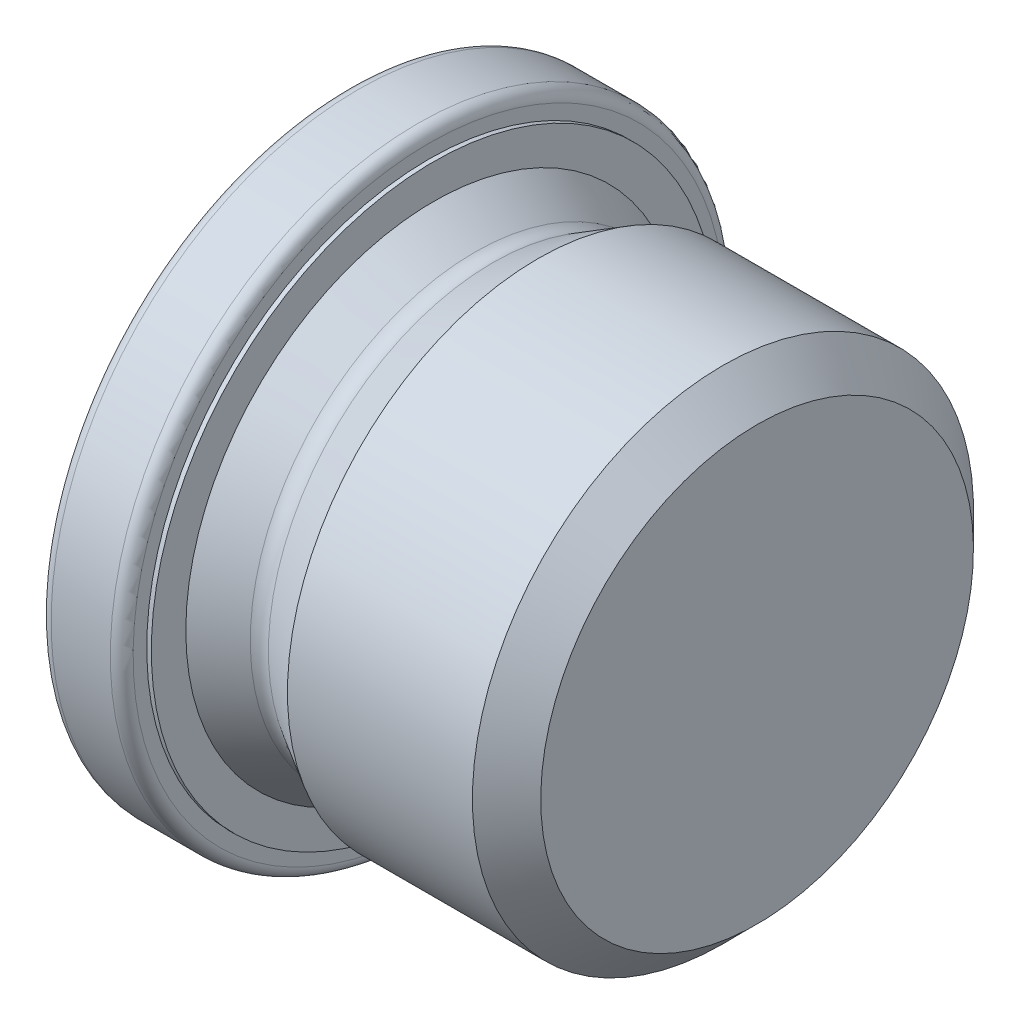
from build123d import *

# Parameters (mm, degrees)
SKETCH2_W          = 9.6
SKETCH2_H          = 9.6
CUT_EXTRUDE1_DEPTH = 10
FILLET1_R          = 0.5
SKETCH3_W          = 1.5
SKETCH3_H          = 2


with BuildPart() as part:
    # Sketch1 → Revolve1 (revolve)
    with BuildSketch(Plane.XY):
        with BuildLine():
            Line((0, 0), (0, 9.5))
            Line((0, 9.5), (-1.5, 11))
            Line((-1.5, 11), (-9.622450166, 11))
            Line((-9.622450166, 11), (-11.60187303, 9.857179677))
            ThreePointArc((-11.60187303, 9.857179677), (-12.000249041, 9.750001648), (-12.399056907, 9.855561401))
            Line((-12.399056907, 9.855561401), (-14.4, 11))
            Line((-14.4, 11), (-14.4, 13.5))
            Line((-14.4, 13.5), (-18, 13.5))
            Line((-18, 13.5), (-18, 0))
            Line((-18, 0), (0, 0))
        make_face()
    revolve(axis=Axis((0, 0, 0), (-1, 0, 0)))

    # Sketch2 → Cut-Extrude1 (cut)
    with BuildSketch(Plane.ZY.offset(18)):
        Rectangle(SKETCH2_W, SKETCH2_H)
    extrude(amount=-CUT_EXTRUDE1_DEPTH, mode=Mode.SUBTRACT)

    # Fillet1
    fillet1_edges = [part.edges().sort_by_distance(p)[0] for p in [
        (-18, -13.5, 0),
        (-14.4, -13.5, 0),
    ]]
    fillet(fillet1_edges, radius=FILLET1_R)

    # Sketch3 → Revolve2 (revolve)
    with BuildSketch(Plane.XY):
        with Locations((-14.95, 11.4)):
            Rectangle(SKETCH3_W, SKETCH3_H)
    revolve(axis=Axis((0, 0, 0), (-1, 0, 0)))


solid = part.part
